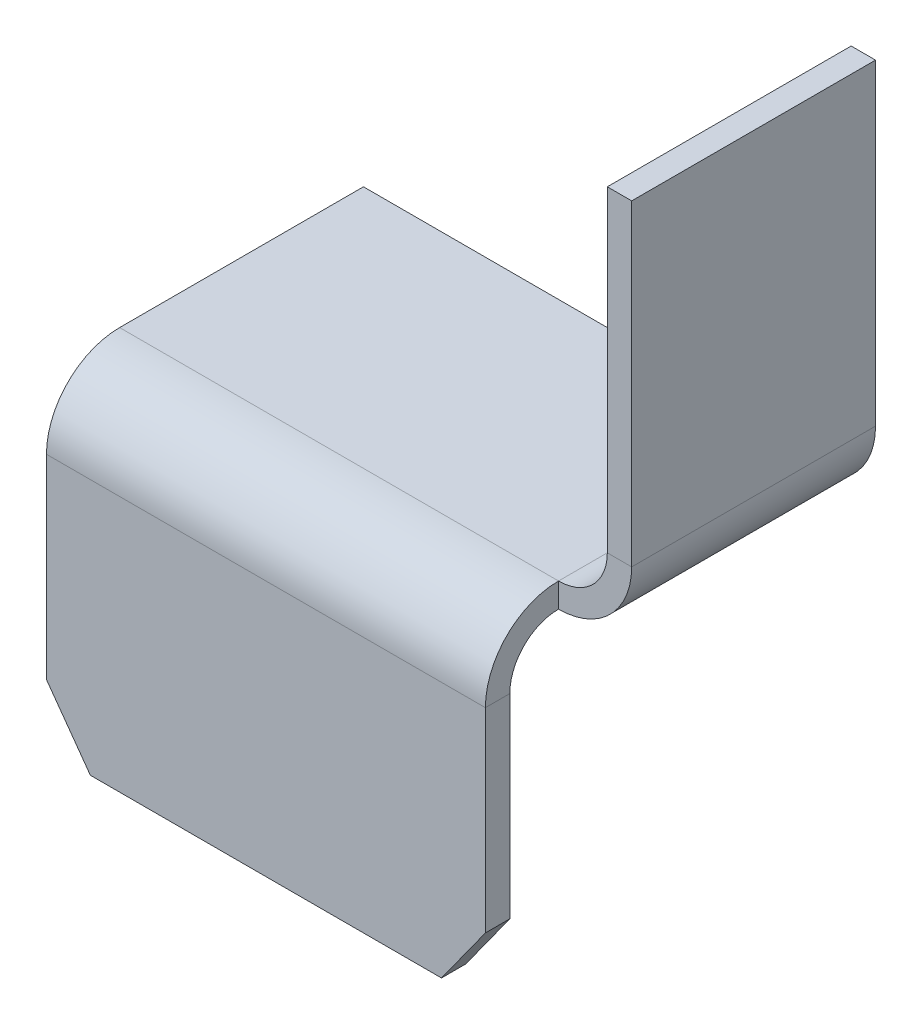
from build123d import *

# Parameters (mm, degrees)
SM_BASE_FLANGE_1_DEPTH      = 10
SM_EDGE_FLANGE_2_DEPTH      = 18
SM_START                    = 1
SM_EDGE_FLANGE_2_FLAT_DEPTH = 1


# Sheet-metal steps are written as plain solids
with BuildPart() as part:
    # Sketch 1 → 基体-法兰1 (new body)
    with BuildSketch(Plane.XY):
        with BuildLine():
            Line((0, 0), (18, 0))
            ThreePointArc((18, 0), (19.414213562, 0.585786438), (20, 2))
            Line((20, 2), (20, 15))
            Line((20, 15), (21, 15))
            Line((21, 15), (21, 2))
            ThreePointArc((21, 2), (20.121320344, -0.121320344), (18, -1))
            Line((18, -1), (0, -1))
            Line((0, -1), (0, 0))
        make_face()
    extrude(amount=SM_BASE_FLANGE_1_DEPTH)

    # 边线-法兰2 bend section (across the edge) → 边线-法兰2 (add)
    with BuildSketch(Plane(origin=(18, -1, 12), x_dir=(0, 0, -1), z_dir=(-1, 0, 0))):
        with BuildLine():
            Line((-1, 2), (0, 2))
            ThreePointArc((0, 2), (0.585786438, 0.585786438), (2, 0))
            Line((2, 0), (2, -1))
            ThreePointArc((2, -1), (-0.121320344, -0.121320344), (-1, 2))
        make_face()
    extrude(amount=SM_EDGE_FLANGE_2_DEPTH)

    # 边线-法兰2 profile (on flange) → 边线-法兰2 flat (add)
    with BuildSketch(Plane(origin=(0, -1, 12), x_dir=(-1, 0, 0), z_dir=(0, 0, 1)).offset(SM_START)):
        Polygon((0, 2), (0, 10), (-1.8, 12.5), (-16.2, 12.5), (-18, 10), (-18, 2), align=None)
    extrude(amount=-SM_EDGE_FLANGE_2_FLAT_DEPTH)


solid = part.part
